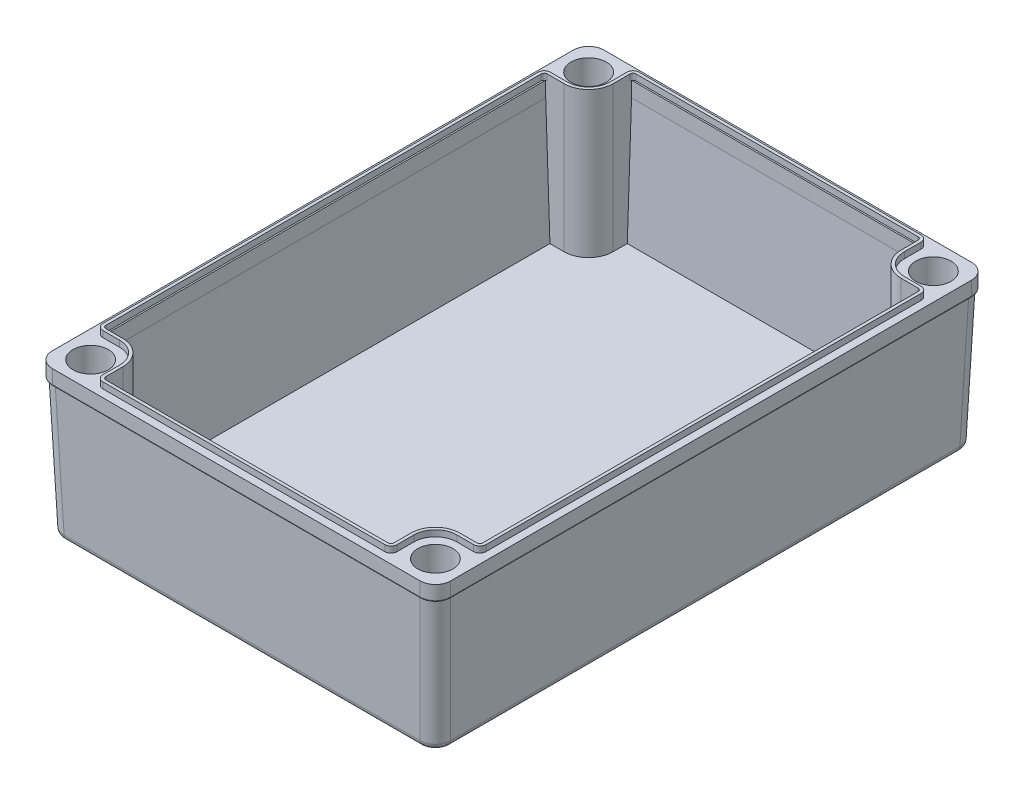
from build123d import *
from build123d.topology import SkipClean

# Parameters (mm, degrees)
SKETCH1_W                       = 126
SKETCH1_H                       = 176
BOSS_EXTRUDE1_DEPTH             = 44
DRAFT1_ANGLE                    = 1.953
SHELL2_T                        = -3.5
SKETCH2_W                       = 130
SKETCH2_H                       = 180
SKETCH2_W_2                     = 129.000754922
SKETCH2_H_2                     = 179.000754922
SKETCH2_W_3                     = 121.996686392
SKETCH2_H_3                     = 171.996686392
BOSS_EXTRUDE2_DEPTH             = 5
BOSS_EXTRUDE3_REACH             = 123.351
CBORE_FOR_M4_SBHCS1_D           = 4.5
CBORE_FOR_M4_SBHCS1_CBORE_D     = 11.5
CBORE_FOR_M4_SBHCS1_CBORE_DEPTH = 46
EXTRUDE_THIN1_START             = 2
EXTRUDE_THIN1_DEPTH             = 2
FILLET2_R                       = 5
FILLET4_R                       = 2
FILLET5_R                       = 0.5
BOSS_EXTRUDE4_START             = -1
SKETCH8_R                       = 5
SKETCH8_R_2                     = 2.25
BOSS_EXTRUDE4_DEPTH             = 1
FILLET6_R                       = 1


with BuildPart() as part:
    # Sketch1 → Boss-Extrude1 (new body)
    with BuildSketch(Plane(origin=(0, 0, 0), x_dir=(1, 0, 0), z_dir=(0, 1, 0))):
        Rectangle(SKETCH1_W, SKETCH1_H)
    extrude(amount=BOSS_EXTRUDE1_DEPTH)

    # Draft1
    draft1_faces = [part.faces().sort_by_distance(p)[0] for p in [
        (-63, 22, 0),
        (0, 22, -88),
        (63, 22, 0),
        (0, 22, 88),
    ]]
    draft(draft1_faces, Plane(origin=(0, 0, 0), x_dir=(0, 0, -1), z_dir=(0, -1, 0)), DRAFT1_ANGLE)

    # Shell2
    shell2_openings = [part.faces().sort_by_distance(p)[0] for p in [
        (0, 44, 0),
    ]]
    offset(amount=SHELL2_T, openings=shell2_openings, kind=Kind.INTERSECTION)

    # Sketch2 → Boss-Extrude2 (add)
    # profile 1 of 2: a face of its own
    with BuildSketch(Plane(origin=(0, 44, 0), x_dir=(1, 0, 0), z_dir=(0, 1, 0))):
        Rectangle(SKETCH2_W, SKETCH2_H)
        Rectangle(SKETCH2_W_2, SKETCH2_H_2, mode=Mode.SUBTRACT)
    # profile 2 of 2: a face of its own
    with BuildSketch(Plane(origin=(0, 44, 0), x_dir=(1, 0, 0), z_dir=(0, 1, 0))):
        Rectangle(SKETCH2_W_2, SKETCH2_H_2)
        Rectangle(SKETCH2_W_3, SKETCH2_H_3, mode=Mode.SUBTRACT)
    extrude(amount=BOSS_EXTRUDE2_DEPTH)

    # Boss-Extrude3: up to this face of the body (flat: up to its plane)
    boss_extrude3_end = Plane(part.part.faces().sort_by_distance((0, 3.5, 0))[0])
    # Sketch3 → Boss-Extrude3 (add, up to the picked face)
    with BuildSketch(Plane(origin=(0, 49, 0), x_dir=(1, 0, 0), z_dir=(0, 1, 0)), mode=Mode.PRIVATE) as boss_extrude3_sk1:
        with BuildLine():
            Line((-60.998343196, 72), (-55, 72))
            ThreePointArc((-55, 72), (-49.343145751, 74.343145751), (-47, 80))
            Line((-47, 80), (-47, 85.998343196))
            Line((-47, 85.998343196), (-60.998343196, 85.998343196))
            Line((-60.998343196, 85.998343196), (-60.998343196, 72))
        make_face()
    boss_extrude3_tool1 = split(extrude(boss_extrude3_sk1.sketch, amount=-BOSS_EXTRUDE3_REACH, mode=Mode.PRIVATE), bisect_by=boss_extrude3_end, keep=Keep.BOTH, mode=Mode.PRIVATE)
    # Sketch3 → Boss-Extrude3 (add, up to the picked face)
    with BuildSketch(Plane(origin=(0, 49, 0), x_dir=(1, 0, 0), z_dir=(0, 1, 0)), mode=Mode.PRIVATE) as boss_extrude3_sk2:
        with BuildLine():
            Line((60.998343196, 85.998343196), (47, 85.998343196))
            Line((47, 85.998343196), (47, 80))
            ThreePointArc((47, 80), (49.343145751, 74.343145751), (55, 72))
            Line((55, 72), (60.998343196, 72))
            Line((60.998343196, 72), (60.998343196, 85.998343196))
        make_face()
    boss_extrude3_tool2 = split(extrude(boss_extrude3_sk2.sketch, amount=-BOSS_EXTRUDE3_REACH, mode=Mode.PRIVATE), bisect_by=boss_extrude3_end, keep=Keep.BOTH, mode=Mode.PRIVATE)
    # Sketch3 → Boss-Extrude3 (add, up to the picked face)
    with BuildSketch(Plane(origin=(0, 49, 0), x_dir=(1, 0, 0), z_dir=(0, 1, 0)), mode=Mode.PRIVATE) as boss_extrude3_sk3:
        with BuildLine():
            Line((47, -80), (47, -85.998343196))
            Line((47, -85.998343196), (60.998343196, -85.998343196))
            Line((60.998343196, -85.998343196), (60.998343196, -72))
            Line((60.998343196, -72), (55, -72))
            ThreePointArc((55, -72), (49.343145751, -74.343145751), (47, -80))
        make_face()
    boss_extrude3_tool3 = split(extrude(boss_extrude3_sk3.sketch, amount=-BOSS_EXTRUDE3_REACH, mode=Mode.PRIVATE), bisect_by=boss_extrude3_end, keep=Keep.BOTH, mode=Mode.PRIVATE)
    # Sketch3 → Boss-Extrude3 (add, up to the picked face)
    with BuildSketch(Plane(origin=(0, 49, 0), x_dir=(1, 0, 0), z_dir=(0, 1, 0)), mode=Mode.PRIVATE) as boss_extrude3_sk4:
        with BuildLine():
            Line((-55, -72), (-60.998343196, -72))
            Line((-60.998343196, -72), (-60.998343196, -85.998343196))
            Line((-60.998343196, -85.998343196), (-47, -85.998343196))
            Line((-47, -85.998343196), (-47, -80))
            ThreePointArc((-47, -80), (-49.343145751, -74.343145751), (-55, -72))
        make_face()
    boss_extrude3_tool4 = split(extrude(boss_extrude3_sk4.sketch, amount=-BOSS_EXTRUDE3_REACH, mode=Mode.PRIVATE), bisect_by=boss_extrude3_end, keep=Keep.BOTH, mode=Mode.PRIVATE)
    add(boss_extrude3_tool1.solids().sort_by(Axis((-54.392036, 49, -79.392036), (0, -1, 0)))[0])
    add(boss_extrude3_tool2.solids().sort_by(Axis((54.392036, 49, -79.392036), (0, -1, 0)))[0])
    add(boss_extrude3_tool3.solids().sort_by(Axis((54.392036, 49, 79.392036), (0, -1, 0)))[0])
    add(boss_extrude3_tool4.solids().sort_by(Axis((-54.392036, 49, 79.392036), (0, -1, 0)))[0])

    # CBORE for M4 SBHCS1 (through all)
    with Locations(Plane(origin=(0, 49, 0), x_dir=(1, 0, 0), z_dir=(0, 1, 0))):
        with Locations((-56.25, -81.25), (56.25, -81.25), (56.25, 81.25), (-56.25, 81.25)):
            CounterBoreHole(CBORE_FOR_M4_SBHCS1_D / 2, CBORE_FOR_M4_SBHCS1_CBORE_D / 2, CBORE_FOR_M4_SBHCS1_CBORE_DEPTH)

    # Sketch7 → Extrude-Thin1 (add)
    with BuildSketch(Plane(origin=(0, 49, 0), x_dir=(1, 0, 0), z_dir=(0, 1, 0)).offset(EXTRUDE_THIN1_START)):
        with BuildLine():
            Line((-48, 85.498343196), (-48, 80))
            ThreePointArc((-48, 80), (-50.050252532, 75.050252532), (-55, 73))
            Line((-55, 73), (-60.498343196, 73))
            ThreePointArc((-60.498343196, 73), (-61.912556758, 72.414213562), (-62.498343196, 71))
            Line((-62.498343196, 71), (-62.498343196, -71))
            ThreePointArc((-62.498343196, -71), (-61.912556758, -72.414213562), (-60.498343196, -73))
            Line((-60.498343196, -73), (-55, -73))
            ThreePointArc((-55, -73), (-50.050252532, -75.050252532), (-48, -80))
            Line((-48, -80), (-48, -85.498343196))
            ThreePointArc((-48, -85.498343196), (-47.414213562, -86.912556758), (-46, -87.498343196))
            Line((-46, -87.498343196), (46, -87.498343196))
            ThreePointArc((46, -87.498343196), (47.414213562, -86.912556758), (48, -85.498343196))
            Line((48, -85.498343196), (48, -80))
            ThreePointArc((48, -80), (50.050252532, -75.050252532), (55, -73))
            Line((55, -73), (60.498343196, -73))
            ThreePointArc((60.498343196, -73), (61.912556758, -72.414213562), (62.498343196, -71))
            Line((62.498343196, -71), (62.498343196, 71))
            ThreePointArc((62.498343196, 71), (61.912556758, 72.414213562), (60.498343196, 73))
            Line((60.498343196, 73), (55, 73))
            ThreePointArc((55, 73), (50.050252532, 75.050252532), (48, 80))
            Line((48, 80), (48, 85.498343196))
            ThreePointArc((48, 85.498343196), (47.414213562, 86.912556758), (46, 87.498343196))
            Line((46, 87.498343196), (-46, 87.498343196))
            ThreePointArc((-46, 87.498343196), (-47.414213562, 86.912556758), (-48, 85.498343196))
        make_face()
        with BuildLine():
            Line((-47, 85.498343196), (-47, 80))
            ThreePointArc((-47, 80), (-49.343145751, 74.343145751), (-55, 72))
            Line((-55, 72), (-60.498343196, 72))
            ThreePointArc((-60.498343196, 72), (-61.205449977, 71.707106781), (-61.498343196, 71))
            Line((-61.498343196, 71), (-61.498343196, -71))
            ThreePointArc((-61.498343196, -71), (-61.205449977, -71.707106781), (-60.498343196, -72))
            Line((-60.498343196, -72), (-55, -72))
            ThreePointArc((-55, -72), (-49.343145751, -74.343145751), (-47, -80))
            Line((-47, -80), (-47, -85.498343196))
            ThreePointArc((-47, -85.498343196), (-46.707106781, -86.205449977), (-46, -86.498343196))
            Line((-46, -86.498343196), (46, -86.498343196))
            ThreePointArc((46, -86.498343196), (46.707106781, -86.205449977), (47, -85.498343196))
            Line((47, -85.498343196), (47, -80))
            ThreePointArc((47, -80), (49.343145751, -74.343145751), (55, -72))
            Line((55, -72), (60.498343196, -72))
            ThreePointArc((60.498343196, -72), (61.205449977, -71.707106781), (61.498343196, -71))
            Line((61.498343196, -71), (61.498343196, 71))
            ThreePointArc((61.498343196, 71), (61.205449977, 71.707106781), (60.498343196, 72))
            Line((60.498343196, 72), (55, 72))
            ThreePointArc((55, 72), (49.343145751, 74.343145751), (47, 80))
            Line((47, 80), (47, 85.498343196))
            ThreePointArc((47, 85.498343196), (46.707106781, 86.205449977), (46, 86.498343196))
            Line((46, 86.498343196), (-46, 86.498343196))
            ThreePointArc((-46, 86.498343196), (-46.707106781, 86.205449977), (-47, 85.498343196))
        make_face(mode=Mode.SUBTRACT)
    extrude(amount=-EXTRUDE_THIN1_DEPTH)

    # Fillet2
    fillet2_edges = [part.edges().sort_by_distance(p)[0] for p in [
        (-65, 46.5, 90),
        (65, 46.5, 90),
        (65, 46.5, -90),
        (-65, 46.5, -90),
        (63.750188731, 22, 88.750188731),
        (-63.750188731, 22, 88.750188731),
        (-63.750188731, 22, -88.750188731),
        (63.750188731, 22, -88.750188731),
    ]]
    fillet(fillet2_edges, radius=FILLET2_R)

    # Fillet4
    fillet4_edges = [part.edges().sort_by_distance(p)[0] for p in [
        (0, 0, -88),
        (63, 0, 0),
        (0, 0, 88),
        (-63, 0, 0),
        (-61.536736456, 0, 86.536736456),
        (61.536736456, 0, 86.536736456),
        (-61.536736456, 0, -86.536736456),
        (61.536736456, 0, -86.536736456),
    ]]
    fillet(fillet4_edges, radius=FILLET4_R)

    # Fillet5
    fillet5_edges = [part.edges().sort_by_distance(p)[0] for p in [
        (65, 44, 0),
        (0, 44, 90),
        (-65, 44, 0),
        (0, 44, -90),
        (63.535533906, 44, -88.535533906),
        (-63.535533906, 44, -88.535533906),
        (-63.535533906, 44, 88.535533906),
        (63.535533906, 44, 88.535533906),
    ]]
    fillet(fillet5_edges, radius=FILLET5_R)

    # Sketch8 → Boss-Extrude4 (add)
    # profile 1 of 12: a face of its own
    with SkipClean():  # the faces are left unmerged after this step: merging them gives an invalid solid
        with BuildSketch(Plane(origin=(0, 0, 0), x_dir=(1, 0, 0), z_dir=(0, 1, 0)).offset(BOSS_EXTRUDE4_START)):
            with Locations(Location((0, 70, 0), (0, 0, 270))):
                Circle(SKETCH8_R)
        # profile 2 of 12: a face of its own
        with BuildSketch(Plane(origin=(0, 0, 0), x_dir=(1, 0, 0), z_dir=(0, 1, 0)).offset(BOSS_EXTRUDE4_START)):
            with Locations(Location((-45, 50, 0), (0, 0, 270))):
                Circle(SKETCH8_R)
        # profile 3 of 12: a face of its own
        with BuildSketch(Plane(origin=(0, 0, 0), x_dir=(1, 0, 0), z_dir=(0, 1, 0)).offset(BOSS_EXTRUDE4_START)):
            with Locations(Location((-45, 0, 0), (0, 0, 270))):
                Circle(SKETCH8_R)
        # profile 4 of 12: a face of its own
        with BuildSketch(Plane(origin=(0, 0, 0), x_dir=(1, 0, 0), z_dir=(0, 1, 0)).offset(BOSS_EXTRUDE4_START)):
            with Locations(Location((-45, -50, 0), (0, 0, 270))):
                Circle(SKETCH8_R)
        # profile 5 of 12: a face of its own
        with BuildSketch(Plane(origin=(0, 0, 0), x_dir=(1, 0, 0), z_dir=(0, 1, 0)).offset(BOSS_EXTRUDE4_START)):
            with Locations(Location((0, -70, 0), (0, 0, 270))):
                Circle(SKETCH8_R)
        # profile 6 of 12: a face of its own
        with BuildSketch(Plane(origin=(0, 0, 0), x_dir=(1, 0, 0), z_dir=(0, 1, 0)).offset(BOSS_EXTRUDE4_START)):
            with Locations(Location((45, -50, 0), (0, 0, 270))):
                Circle(SKETCH8_R)
        # profile 7 of 12: a face of its own
        with BuildSketch(Plane(origin=(0, 0, 0), x_dir=(1, 0, 0), z_dir=(0, 1, 0)).offset(BOSS_EXTRUDE4_START)):
            with Locations(Location((45, 0, 0), (0, 0, 270))):
                Circle(SKETCH8_R)
        # profile 8 of 12: a face of its own
        with BuildSketch(Plane(origin=(0, 0, 0), x_dir=(1, 0, 0), z_dir=(0, 1, 0)).offset(BOSS_EXTRUDE4_START)):
            with Locations(Location((45, 50, 0), (0, 0, 270))):
                Circle(SKETCH8_R)
        # profile 9 of 12: a face of its own
        with BuildSketch(Plane(origin=(0, 0, 0), x_dir=(1, 0, 0), z_dir=(0, 1, 0)).offset(BOSS_EXTRUDE4_START)):
            with Locations(Location((-56.25, -81.25, 0), (0, 0, 270))):
                Circle(SKETCH8_R)
            with Locations(Location((-56.25, -81.25, 0), (0, 0, 270))):
                Circle(SKETCH8_R_2, mode=Mode.SUBTRACT)
        # profile 10 of 12: a face of its own
        with BuildSketch(Plane(origin=(0, 0, 0), x_dir=(1, 0, 0), z_dir=(0, 1, 0)).offset(BOSS_EXTRUDE4_START)):
            with Locations(Location((56.25, -81.25, 0), (0, 0, 270))):
                Circle(SKETCH8_R)
            with Locations(Location((56.25, -81.25, 0), (0, 0, 270))):
                Circle(SKETCH8_R_2, mode=Mode.SUBTRACT)
        # profile 11 of 12: a face of its own
        with BuildSketch(Plane(origin=(0, 0, 0), x_dir=(1, 0, 0), z_dir=(0, 1, 0)).offset(BOSS_EXTRUDE4_START)):
            with Locations(Location((56.25, 81.25, 0), (0, 0, 270))):
                Circle(SKETCH8_R)
            with Locations(Location((56.25, 81.25, 0), (0, 0, 270))):
                Circle(SKETCH8_R_2, mode=Mode.SUBTRACT)
        # profile 12 of 12: a face of its own
        with BuildSketch(Plane(origin=(0, 0, 0), x_dir=(1, 0, 0), z_dir=(0, 1, 0)).offset(BOSS_EXTRUDE4_START)):
            with Locations(Location((-56.25, 81.25, 0), (0, 0, 270))):
                Circle(SKETCH8_R)
            with Locations(Location((-56.25, 81.25, 0), (0, 0, 270))):
                Circle(SKETCH8_R_2, mode=Mode.SUBTRACT)
        extrude(amount=BOSS_EXTRUDE4_DEPTH)

    # Fillet6
    fillet6_edges = [part.edges().sort_by_distance(p)[0] for p in [
        (0, -1, -75),
        (-45, -1, -55),
        (-45, -1, -5),
        (-45, -1, 45),
        (0, -1, 65),
        (45, -1, 45),
        (45, -1, -5),
        (45, -1, -55),
        (-56.25, -1, 76.25),
        (56.25, -1, 76.25),
        (56.25, -1, -86.25),
        (-56.25, -1, -86.25),
    ]]
    fillet(fillet6_edges, radius=FILLET6_R - 0.0001)  # a hair under: the kernel refuses the full size


solid = part.part
